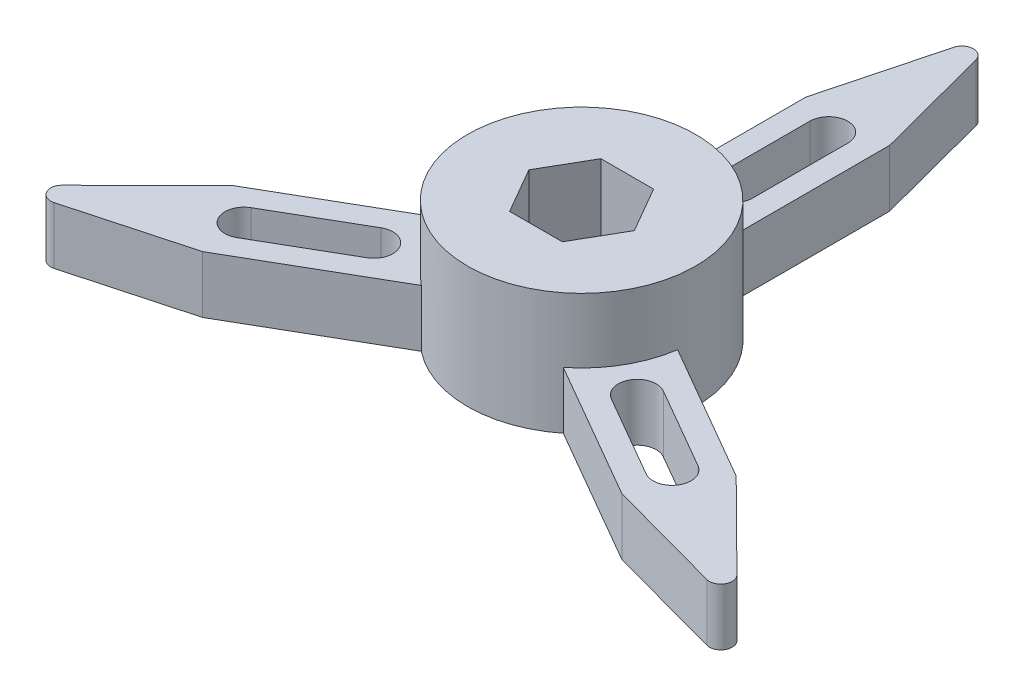
from build123d import *

# Parameters (mm, degrees)
SKETCH1_R           = 30
BOSS_EXTRUDE1_DEPTH = 32
BOSS_EXTRUDE2_DEPTH = 15
CIRPATTERN2_COUNT   = 3


with BuildPart() as part:
    # Sketch1 → Boss-Extrude1 (new body)
    with BuildSketch(Plane(origin=(0, 0, 0), x_dir=(1, 0, 0), z_dir=(0, 1, 0))):
        with Locations(Location((0, 0, 0), (0, 0, 270))):
            Circle(SKETCH1_R)
        Polygon((6.92820323, -12), (13.856406461, 0), (6.92820323, 12), (-6.92820323, 12), (-13.856406461, 0), (-6.92820323, -12), align=None, mode=Mode.SUBTRACT)
    extrude(amount=BOSS_EXTRUDE1_DEPTH)

    # Sketch1<3> → Boss-Extrude2 (add)
    with BuildSketch(Plane(origin=(0, 0, 0), x_dir=(1, 0, 0), z_dir=(0, 1, 0))):
        with BuildLine():
            Line((11, 27.910571474), (11, 70))
            Line((11, 70), (2.901151097, 100.763755402))
            ThreePointArc((2.901151097, 100.763755402), (0, 103), (-2.901151097, 100.763755402))
            Line((-2.901151097, 100.763755402), (-11, 70))
            Line((-11, 70), (-11, 27.910571474))
            ThreePointArc((-11, 27.910571474), (0, 30), (11, 27.910571474))
        make_face()
        with BuildLine():
            ThreePointArc((5, 40), (0, 35), (-5, 40))
            Line((-5, 40), (-5, 65))
            ThreePointArc((-5, 65), (0, 70), (5, 65))
            Line((5, 65), (5, 40))
        make_face(mode=Mode.SUBTRACT)
    extrude(amount=BOSS_EXTRUDE2_DEPTH)


with BuildPart() as cirpattern2_1:
    # CirPattern2: pattern copy
    add(part.part.rotate(Axis((0, 0, 0), (0, 1, 0)), 1 * 360 / CIRPATTERN2_COUNT))


with BuildPart() as cirpattern2_2:
    # CirPattern2: pattern copy
    add(part.part.rotate(Axis((0, 0, 0), (0, 1, 0)), 2 * 360 / CIRPATTERN2_COUNT))

    # Combine2: read off the stored shape, not the designer's step
    # Combine2: union part, CirPattern2_1
    add(part.part)
    add(cirpattern2_1.part)


solid = cirpattern2_2.part
